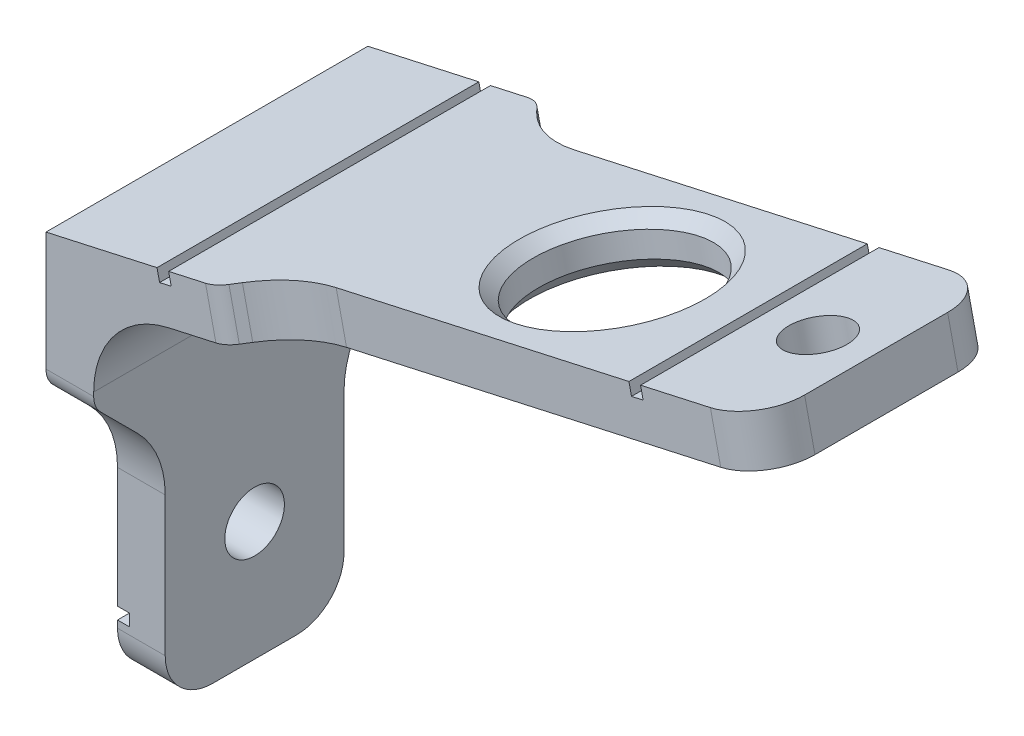
from build123d import *
from OCP.BRepFilletAPI import BRepFilletAPI_MakeFillet

# Parameters (mm, degrees)
BOSS_EXTRUDE1_DEPTH = 5
BOSS_EXTRUDE2_DEPTH = 6.75
CHAMFER1_SIZE       = 3
CUT_EXTRUDE1_DEPTH  = 51.906134019
FILLET1_R1          = 1
FILLET1_R2          = 4
FILLET2_R           = 4
FILLET3_R           = 2
SKETCH5_R           = 1.25
CUT_EXTRUDE2_DEPTH  = 51.906134019
SKETCH6_R           = 1.25
CUT_EXTRUDE3_DEPTH  = 29.824774908
FILLET4_R           = 2
SKETCH7_R           = 3.5
CUT_EXTRUDE4_DEPTH  = 29.824774908
CHAMFER2_SIZE       = 0.5


with BuildPart() as part:
    # Sketch1 → Boss-Extrude1 (new, symmetric)
    with BuildSketch(Plane.XY):
        Polygon((-15, 33.787773645), (11.504683177, 39.681261814), (11.070572477, 41.63358041), (6.189775987, 40.548303662), (6.298303662, 40.060224013), (5.810224013, 39.951696338), (5.701696338, 40.439775987), (-11.855909094, 36.53572857), (-11.747381419, 36.047648921), (-12.235461068, 35.939121246), (-12.343988743, 36.427200895), (-17, 35.391906601), (-17, 20.3), (-16.5, 20.3), (-16.5, 19.8), (-17, 19.8), (-17, 17.5), (-15, 17.5), align=None)
    extrude(amount=BOSS_EXTRUDE1_DEPTH, both=True)

    # Sketch3 → Boss-Extrude2 (add, symmetric)
    with BuildSketch(Plane.XY):
        Polygon((-6.541001904, 35.668686722), (-6.975112604, 37.621005318), (-11.855909094, 36.53572857), (-11.747381419, 36.047648921), (-12.235461068, 35.939121246), (-12.343988743, 36.427200895), (-17, 35.391906601), (-17, 20.3), (-16.5, 20.3), (-16.5, 19.8), (-17, 19.8), (-17, 17.5), (-15, 17.5), (-15, 33.787773645), align=None)
    extrude(amount=BOSS_EXTRUDE2_DEPTH, both=True)

    # Chamfer1
    # the kernel refuses this chamfer: 3 mm, written as the material it takes off along each edge
    with BuildSketch(Plane(origin=(-4.866409254, 28.137569941, -6.75), x_dir=(0.0268403556117362, 0.005968127111591266, 0.9996219169112968), z_dir=(-0.21705534964808215, 0.9761592980600804, 0))) as chamfer1_piece_1_section:
        Polygon((CHAMFER1_SIZE * 0.999621916911, -CHAMFER1_SIZE * 0.0274958766106), (-CHAMFER1_SIZE * 0.0274958766106, -CHAMFER1_SIZE * 0.999621916911), (0, 0), align=None)
    chamfer1_piece_1 = extrude(amount=17.430097928, mode=Mode.PRIVATE)
    chamfer1_piece_1 = split(chamfer1_piece_1, bisect_by=Plane(origin=(-7.864790055, 36.398756806, -5), z_dir=(0, 0, -1)), keep=Keep.TOP, mode=Mode.PRIVATE)
    add(chamfer1_piece_1, mode=Mode.SUBTRACT)
    with BuildSketch(Plane(origin=(-4.866409254, 28.137569941, 6.75), x_dir=(-0.9757902287376033, -0.2169732846910676, 0.02749587661058649), z_dir=(-0.21705534964808215, 0.9761592980600804, 0))) as chamfer1_piece_2_section:
        Polygon((CHAMFER1_SIZE * 0.999621916911, -CHAMFER1_SIZE * 0.0274958766106), (-CHAMFER1_SIZE * 0.0274958766106, -CHAMFER1_SIZE * 0.999621916911), (0, 0), align=None)
    chamfer1_piece_2 = extrude(amount=17.430097928, mode=Mode.PRIVATE)
    chamfer1_piece_2 = split(chamfer1_piece_2, bisect_by=Plane(origin=(-7.864790055, 36.398756806, 5), z_dir=(0, 0, 1)), keep=Keep.TOP, mode=Mode.PRIVATE)
    add(chamfer1_piece_2, mode=Mode.SUBTRACT)

    # Sketch4 → Cut-Extrude1 (cut, through all)
    with BuildSketch(Plane.ZY.offset(17)):
        Polygon((-6.75, 30), (-3.75, 27), (-3.75, 17.5), (3.75, 17.5), (3.75, 27), (6.75, 30), (6.75, 0), (-6.75, 0), align=None)
    extrude(amount=-CUT_EXTRUDE1_DEPTH, mode=Mode.SUBTRACT)

    # Fillet1: one fillet with a radius per group of edges: ONE call of the kernel's fillet builder (fillet() takes one radius for all edges)
    fillet1_edges_1 = [part.edges().sort_by_distance(p)[0] for p in [
        (-9.686535148, 35.993679971, -6.75),
        (-9.686535148, 35.993679971, 6.75),
        (-16, 30, 6.75),
        (-16, 30, -6.75),
    ]]
    fillet1_edges_2 = [part.edges().sort_by_distance(p)[0] for p in [
        (-7.978256377, 36.373526833, 5),
        (-7.978256377, 36.373526833, -5),
        (-16, 27, -3.75),
        (-16, 27, 3.75),
    ]]
    fillet1 = BRepFilletAPI_MakeFillet(part.part.solid().wrapped)
    for e in fillet1_edges_1:
        fillet1.Add(FILLET1_R1, e.wrapped)
    for e in fillet1_edges_2:
        fillet1.Add(FILLET1_R2, e.wrapped)
    add(Compound.cast(fillet1.Shape()), mode=Mode.REPLACE)

    # Fillet2
    fillet2_edges = [part.edges().sort_by_distance(p)[0] for p in [
        (-15, 33.787773645, 0),
    ]]
    fillet(fillet2_edges, radius=FILLET2_R)

    # Fillet3
    fillet3_edges = [part.edges().sort_by_distance(p)[0] for p in [
        (-16, 17.5, -3.75),
        (-16, 17.5, 3.75),
    ]]
    fillet(fillet3_edges, radius=FILLET3_R)

    # Sketch5 → Cut-Extrude2 (cut, through all)
    with BuildSketch(Plane.ZY.offset(17)):
        with Locations(Location((0, 22.5, 0), (0, 0, 270))):
            Circle(SKETCH5_R)
    extrude(amount=-CUT_EXTRUDE2_DEPTH, mode=Mode.SUBTRACT)

    # Sketch6 → Cut-Extrude3 (cut, through all)
    with BuildSketch(Plane(origin=(-8.299779748, 37.326456989, 0), x_dir=(0.9761592980600814, 0.21705534964807782, 0), z_dir=(-0.21705534964807782, 0.9761592980600814, 0))):
        with Locations(Location((17.343433612, 0, 0), (0, 0, 180))):
            Circle(SKETCH6_R)
    extrude(amount=-CUT_EXTRUDE3_DEPTH, mode=Mode.SUBTRACT)

    # Fillet4
    fillet4_edges = [part.edges().sort_by_distance(p)[0] for p in [
        (11.287627827, 40.657421112, -5),
        (11.287627827, 40.657421112, 5),
    ]]
    fillet(fillet4_edges, radius=FILLET4_R)

    # Sketch7 → Cut-Extrude4 (cut, through all)
    with BuildSketch(Plane(origin=(-8.299779748, 37.326456989, 0), x_dir=(0.9761592980600813, 0.21705534964807838, 0), z_dir=(-0.21705534964807838, 0.9761592980600813, 0))):
        with Locations(Location((8.502484958, 0, 0), (0, 0, 180))):
            Circle(SKETCH7_R)
    extrude(amount=-CUT_EXTRUDE4_DEPTH, mode=Mode.SUBTRACT)

    # Chamfer2
    chamfer2_edges = [part.edges().sort_by_distance(p)[0] for p in [
        (3.850668243, 37.979341962, 0),
        (3.416557543, 39.931660559, 0),
    ]]
    chamfer(chamfer2_edges, length=CHAMFER2_SIZE)


solid = part.part
